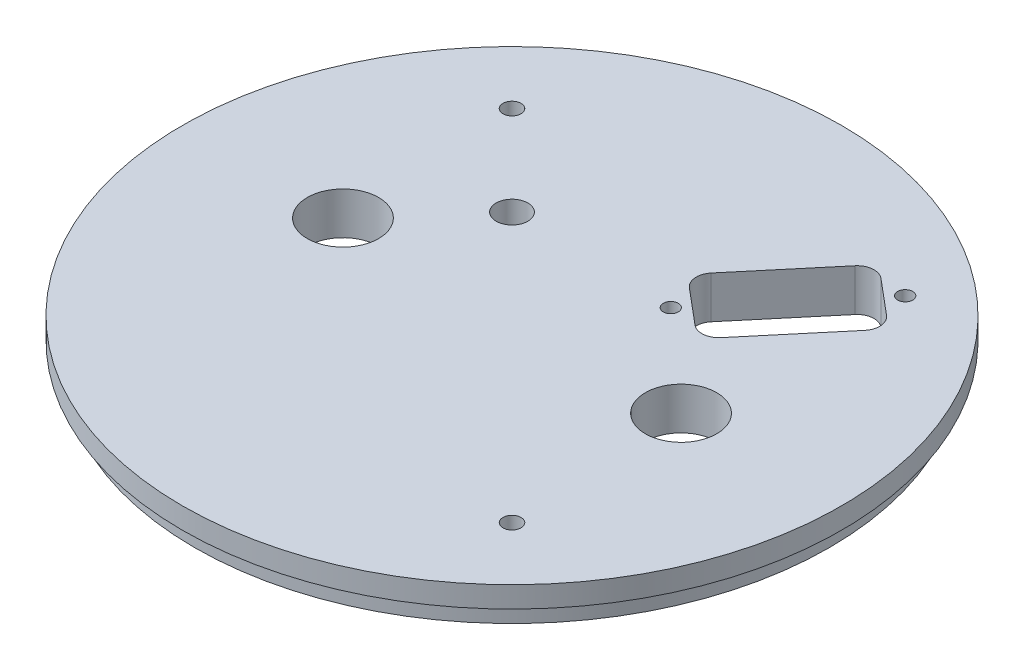
from build123d import *

# Parameters (mm, degrees)
SKETCH1_R                 = 49.5173
SKETCH1_R_2               = 5.3578125
SKETCH1_R_3               = 1.3589
SKETCH1_R_4               = 2.38125
BOSS_EXTRUDE1_DEPTH       = 6.35
SKETCH2_R                 = 49.5173
SKETCH2_R_2               = 47.6885
CUT_EXTRUDE1_DEPTH        = 3.175
CUT_EXTRUDE2_START        = -5.969
CUT_EXTRUDE2_DEPTH        = 3.556
TAP_DRILL_FOR_4_40_TAP1_D = 2.2606
CUT_EXTRUDE3_DEPTH        = 71.315350377


with BuildPart() as part:
    # Sketch1 → Boss-Extrude1 (new body)
    with BuildSketch(Plane(origin=(0, 0, 0), x_dir=(1, 0, 0), z_dir=(0, 1, 0))):
        Circle(SKETCH1_R)
        with Locations((25.4, 0)):
            Circle(SKETCH1_R_2, mode=Mode.SUBTRACT)
        with Locations((-25.4, 0)):
            Circle(SKETCH1_R_2, mode=Mode.SUBTRACT)
        with Locations((-26.940768363, 26.940768363)):
            Circle(SKETCH1_R_3, mode=Mode.SUBTRACT)
        with Locations((26.940768363, -26.940768363)):
            Circle(SKETCH1_R_3, mode=Mode.SUBTRACT)
        with Locations((-13.470384182, 13.470384182)):
            Circle(SKETCH1_R_4, mode=Mode.SUBTRACT)
    extrude(amount=BOSS_EXTRUDE1_DEPTH)

    # Sketch2 → Cut-Extrude1 (cut)
    with BuildSketch(Plane.XZ):
        Circle(SKETCH2_R)
        Circle(SKETCH2_R_2, mode=Mode.SUBTRACT)
    extrude(amount=-CUT_EXTRUDE1_DEPTH, mode=Mode.SUBTRACT)

    # Sketch3 → Cut-Extrude2 (cut)
    with BuildSketch(Plane(origin=(0, 6.35, 0), x_dir=(1, 0, 0), z_dir=(0, 1, 0)).offset(CUT_EXTRUDE2_START)):
        with BuildLine():
            Line((3.2385, 34.925), (3.2385, 13.335))
            ThreePointArc((3.2385, 13.335), (0, 10.0965), (-3.2385, 13.335))
            Line((-3.2385, 13.335), (-3.2385, 34.925))
            ThreePointArc((-3.2385, 34.925), (0, 38.1635), (3.2385, 34.925))
        make_face()
        with BuildLine():
            Line((3.2385, -34.925), (3.2385, -13.335))
            ThreePointArc((3.2385, -13.335), (0, -10.0965), (-3.2385, -13.335))
            Line((-3.2385, -13.335), (-3.2385, -34.925))
            ThreePointArc((-3.2385, -34.925), (0, -38.1635), (3.2385, -34.925))
        make_face()
    extrude(amount=-CUT_EXTRUDE2_DEPTH, mode=Mode.SUBTRACT)

    # Tap Drill for #4-40 Tap1 (through all)
    with Locations(Plane(origin=(0, 6.35, 0), x_dir=(1, 0, 0), z_dir=(0, 1, 0))):
        with Locations((10.884536857, 12.971685903), (26.954227124, 32.122797011)):
            Hole(TAP_DRILL_FOR_4_40_TAP1_D / 2)

    # Sketch4 → Cut-Extrude3 (cut, through all)
    with BuildSketch(Plane(origin=(0, 6.35, 0), x_dir=(1, 0, 0), z_dir=(0, 1, 0))):
        with BuildLine():
            Line((9.727182938, 16.926982214), (14.980715729, 12.518744787))
            ThreePointArc((14.980715729, 12.518744787), (16.834771844, 11.934163139), (18.559149143, 12.831817144))
            Line((18.559149143, 12.831817144), (28.424653401, 24.589067286))
            ThreePointArc((28.424653401, 24.589067286), (29.009235048, 26.443123401), (28.111581044, 28.1675007))
            Line((28.111581044, 28.1675007), (22.858048253, 32.575738127))
            ThreePointArc((22.858048253, 32.575738127), (21.003992138, 33.160319775), (19.279614839, 32.26266577))
            Line((19.279614839, 32.26266577), (9.414110581, 20.505415628))
            ThreePointArc((9.414110581, 20.505415628), (8.829528933, 18.651359513), (9.727182938, 16.926982214))
        make_face()
    extrude(amount=-CUT_EXTRUDE3_DEPTH, mode=Mode.SUBTRACT)


solid = part.part
